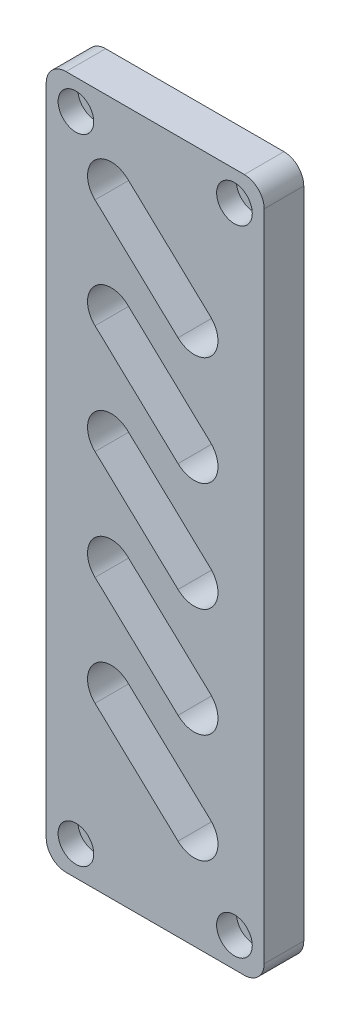
from build123d import *

# Parameters (mm, degrees)
SKETCH_1_W          = 11
SKETCH_1_H          = 35
EXTRUDE_1_DEPTH     = 2
FILLET_1_R          = 1
SKETCH_2_W          = 1
SKETCH_2_H          = 27.801195883
SKETCH_2_H_2        = 12.696804569
SKETCH_2_W_2        = 6.728012357
SKETCH_2_H_3        = 1
SKETCH_2_W_3        = 6.596948746
EXTRUDE_2_DEPTH     = 1
SKETCH_3_W          = 6.641337803
SKETCH_3_H          = 0.5
EXTRUDE_3_DEPTH     = 0.5
SKETCH_4_W          = 0.5
SKETCH_4_H          = 12.696804569
EXTRUDE_4_DEPTH     = 0.5
SKETCH_5_W          = 6.728012357
SKETCH_5_H          = 0.5
EXTRUDE_5_DEPTH     = 0.5
SKETCH_6_W          = 0.5
SKETCH_6_H          = 27.801195883
EXTRUDE_6_DEPTH     = 0.5
CHAMFER_1_SIZE      = 0.5
CUT_EXTRUDE_1_REACH = 60.195
SKETCH_8_R          = 0.9
CUT_EXTRUDE_2_DEPTH = 1
SKETCH_9_R          = 0.5
CUT_EXTRUDE_3_DEPTH = 1


with BuildPart() as part:
    # 草图1 → 凸台-拉伸1 (new body)
    with BuildSketch(Plane.XY):
        with Locations((48.44429715, 4.125412508)):
            Rectangle(SKETCH_1_W, SKETCH_1_H)
    extrude(amount=EXTRUDE_1_DEPTH)

    # 圆角1
    fillet_1_edges = [part.edges().sort_by_distance(p)[0] for p in [
        (42.94429715, 21.625412508, 1),
        (53.94429715, 21.625412508, 1),
        (53.94429715, -13.374587492, 1),
        (42.94429715, -13.374587492, 1),
    ]]
    fillet(fillet_1_edges, radius=FILLET_1_R)

    # 草图2 → 凸台-拉伸2 (add)
    with BuildSketch(Plane(origin=(0, 0, 0), x_dir=(-1, 0, 0), z_dir=(0, 0, -1))):
        with Locations((-52.444918102, 4.669937054)):
            Rectangle(SKETCH_2_W, SKETCH_2_H)
        with Locations((-44.44429715, 10.285527485)):
            Rectangle(SKETCH_2_W, SKETCH_2_H_2)
        with Locations((-48.555014421, 20.125412508)):
            Rectangle(SKETCH_2_W_2, SKETCH_2_H_3)
        with Locations((-48.47250239, -11.874587492)):
            Rectangle(SKETCH_2_W_3, SKETCH_2_H_3)
    extrude(amount=EXTRUDE_2_DEPTH)

    # 草图3 → 凸台-拉伸3 (add)
    with BuildSketch(Plane.XZ.offset(12.374587492)):
        with Locations((48.494696919, -0.75)):
            Rectangle(SKETCH_3_W, SKETCH_3_H)
    extrude(amount=EXTRUDE_3_DEPTH)

    # 草图4 → 凸台-拉伸4 (add)
    with BuildSketch(Plane.ZY.offset(-43.94429715)):
        with Locations((-0.75, 10.285527485)):
            Rectangle(SKETCH_4_W, SKETCH_4_H)
    extrude(amount=EXTRUDE_4_DEPTH)

    # 草图5 → 凸台-拉伸5 (add)
    with BuildSketch(Plane(origin=(0, 20.625412508, 0), x_dir=(1, 0, 0), z_dir=(0, 1, 0))):
        with Locations((48.555014421, 0.75)):
            Rectangle(SKETCH_5_W, SKETCH_5_H)
    extrude(amount=EXTRUDE_5_DEPTH)

    # 草图6 → 凸台-拉伸6 (add)
    with BuildSketch(Plane(origin=(52.944918102, 0, 0), x_dir=(0, 0, -1), z_dir=(1, 0, 0))):
        with Locations((0.75, 4.669937054)):
            Rectangle(SKETCH_6_W, SKETCH_6_H)
    extrude(amount=EXTRUDE_6_DEPTH)

    # 倒角1
    chamfer_1_edges = [part.edges().sort_by_distance(p)[0] for p in [
        (48.494696919, -12.874587492, -1),
        (53.444918102, 4.669937054, -1),
        (48.555014421, 21.125412508, -1),
        (43.44429715, 10.285527485, -1),
    ]]
    chamfer(chamfer_1_edges, length=CHAMFER_1_SIZE - 0.0001)  # a hair under: the kernel refuses the full size

    # 草图7 → 切除-拉伸1 (cut, up to next)
    with BuildSketch(Plane.XY.offset(2), mode=Mode.PRIVATE) as cut_extrude_1_sk1:
        with BuildLine():
            Line((47.04721821, 18.494490282), (51.235350906, 14.562121415))
            ThreePointArc((51.235350906, 14.562121415), (51.288650219, 12.86986824), (49.596397044, 12.816568927))
            Line((49.596397044, 12.816568927), (45.408264348, 16.748937794))
            ThreePointArc((45.408264348, 16.748937794), (45.354965035, 18.441190969), (47.04721821, 18.494490282))
        make_face()
    cut_extrude_1_tool1 = extrude(cut_extrude_1_sk1.sketch, amount=-CUT_EXTRUDE_1_REACH, mode=Mode.PRIVATE) & part.part
    # 草图7 → 切除-拉伸1 (cut, up to next)
    with BuildSketch(Plane.XY.offset(2), mode=Mode.PRIVATE) as cut_extrude_1_sk2:
        with BuildLine():
            Line((45.408264348, 11.248937794), (49.596397044, 7.316568927))
            ThreePointArc((49.596397044, 7.316568927), (51.288650219, 7.36986824), (51.235350906, 9.062121415))
            Line((51.235350906, 9.062121415), (47.04721821, 12.994490282))
            ThreePointArc((47.04721821, 12.994490282), (45.354965035, 12.941190969), (45.408264348, 11.248937794))
        make_face()
    cut_extrude_1_tool2 = extrude(cut_extrude_1_sk2.sketch, amount=-CUT_EXTRUDE_1_REACH, mode=Mode.PRIVATE) & part.part
    # 草图7 → 切除-拉伸1 (cut, up to next)
    with BuildSketch(Plane.XY.offset(2), mode=Mode.PRIVATE) as cut_extrude_1_sk3:
        with BuildLine():
            Line((45.408264348, 5.748937794), (49.596397044, 1.816568927))
            ThreePointArc((49.596397044, 1.816568927), (51.288650219, 1.86986824), (51.235350906, 3.562121415))
            Line((51.235350906, 3.562121415), (47.04721821, 7.494490282))
            ThreePointArc((47.04721821, 7.494490282), (45.354965035, 7.441190969), (45.408264348, 5.748937794))
        make_face()
    cut_extrude_1_tool3 = extrude(cut_extrude_1_sk3.sketch, amount=-CUT_EXTRUDE_1_REACH, mode=Mode.PRIVATE) & part.part
    # 草图7 → 切除-拉伸1 (cut, up to next)
    with BuildSketch(Plane.XY.offset(2), mode=Mode.PRIVATE) as cut_extrude_1_sk4:
        with BuildLine():
            Line((45.408264348, 0.248937794), (49.596397044, -3.683431073))
            ThreePointArc((49.596397044, -3.683431073), (51.288650219, -3.63013176), (51.235350906, -1.937878585))
            Line((51.235350906, -1.937878585), (47.04721821, 1.994490282))
            ThreePointArc((47.04721821, 1.994490282), (45.354965035, 1.941190969), (45.408264348, 0.248937794))
        make_face()
    cut_extrude_1_tool4 = extrude(cut_extrude_1_sk4.sketch, amount=-CUT_EXTRUDE_1_REACH, mode=Mode.PRIVATE) & part.part
    # 草图7 → 切除-拉伸1 (cut, up to next)
    with BuildSketch(Plane.XY.offset(2), mode=Mode.PRIVATE) as cut_extrude_1_sk5:
        with BuildLine():
            Line((45.408264348, -5.251062206), (49.596397044, -9.183431073))
            ThreePointArc((49.596397044, -9.183431073), (51.288650219, -9.13013176), (51.235350906, -7.437878585))
            Line((51.235350906, -7.437878585), (47.04721821, -3.505509718))
            ThreePointArc((47.04721821, -3.505509718), (45.354965035, -3.558809031), (45.408264348, -5.251062206))
        make_face()
    cut_extrude_1_tool5 = extrude(cut_extrude_1_sk5.sketch, amount=-CUT_EXTRUDE_1_REACH, mode=Mode.PRIVATE) & part.part
    add(cut_extrude_1_tool1.solids().sort_by_distance((48.321808, 15.65553, 2))[0], mode=Mode.SUBTRACT)
    add(cut_extrude_1_tool2.solids().sort_by_distance((48.321808, 10.15553, 2))[0], mode=Mode.SUBTRACT)
    add(cut_extrude_1_tool3.solids().sort_by_distance((48.321808, 4.65553, 2))[0], mode=Mode.SUBTRACT)
    add(cut_extrude_1_tool4.solids().sort_by_distance((48.321808, -0.84447, 2))[0], mode=Mode.SUBTRACT)
    add(cut_extrude_1_tool5.solids().sort_by_distance((48.321808, -6.34447, 2))[0], mode=Mode.SUBTRACT)

    # 草图8 → 切除-拉伸2 (cut)
    with BuildSketch(Plane.XY.offset(2)):
        with Locations((44.44429715, 20.125412508)):
            Circle(SKETCH_8_R)
        with Locations((52.44429715, 20.125412508)):
            Circle(SKETCH_8_R)
        with Locations((44.44429715, -11.874587492)):
            Circle(SKETCH_8_R)
        with Locations((52.44429715, -11.874587492)):
            Circle(SKETCH_8_R)
    extrude(amount=-CUT_EXTRUDE_2_DEPTH, mode=Mode.SUBTRACT)

    # 草图9 → 切除-拉伸3 (cut)
    with BuildSketch(Plane.XY.offset(1)):
        with Locations((44.44429715, 20.125412508)):
            Circle(SKETCH_9_R)
        with Locations((52.44429715, 20.125412508)):
            Circle(SKETCH_9_R)
        with Locations((52.44429715, -11.874587492)):
            Circle(SKETCH_9_R)
        with Locations((44.44429715, -11.874587492)):
            Circle(SKETCH_9_R)
    extrude(amount=-CUT_EXTRUDE_3_DEPTH, mode=Mode.SUBTRACT)


solid = part.part
